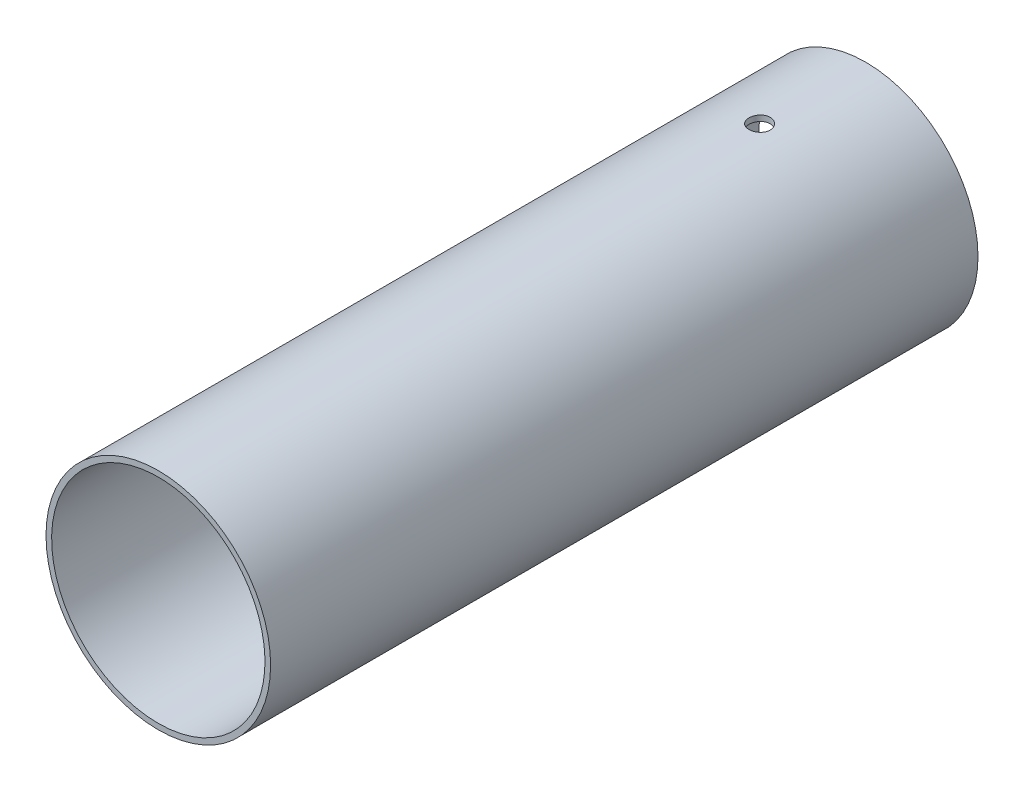
from build123d import *

# Parameters (mm, degrees)
SKETCH2_W              = 3.175
SKETCH2_H              = 400
CUT_REVOLVE4_START     = 60.025874806
CUT_REVOLVE4_OUTLINE_R = 6
CUT_REVOLVE4_DEPTH     = 3.474125294


# Read off the part's stored shape, not the designer's step: Cut-Revolve4
with BuildPart() as part:
    # Sketch2 → Revolve1 (revolve)
    with BuildSketch(Plane.YZ, mode=Mode.PRIVATE) as revolve1_sk:
        with Locations((61.9125, -200)):
            Rectangle(SKETCH2_W, SKETCH2_H)
    revolve(revolve1_sk.sketch.rotate(Axis((0, 0, 0), (0, 0, -1)), 180), axis=Axis((0, 0, 0), (0, 0, -1)))

    # Cut-Revolve4 outline → Cut-Revolve4 (cut)
    with BuildSketch(Plane(origin=(0, 0, 0), x_dir=(1, 0, 0), z_dir=(0, 1, 0)).offset(CUT_REVOLVE4_START)):
        with Locations((0, 340)):
            Circle(CUT_REVOLVE4_OUTLINE_R)
    extrude(amount=CUT_REVOLVE4_DEPTH, mode=Mode.SUBTRACT)


solid = part.part
